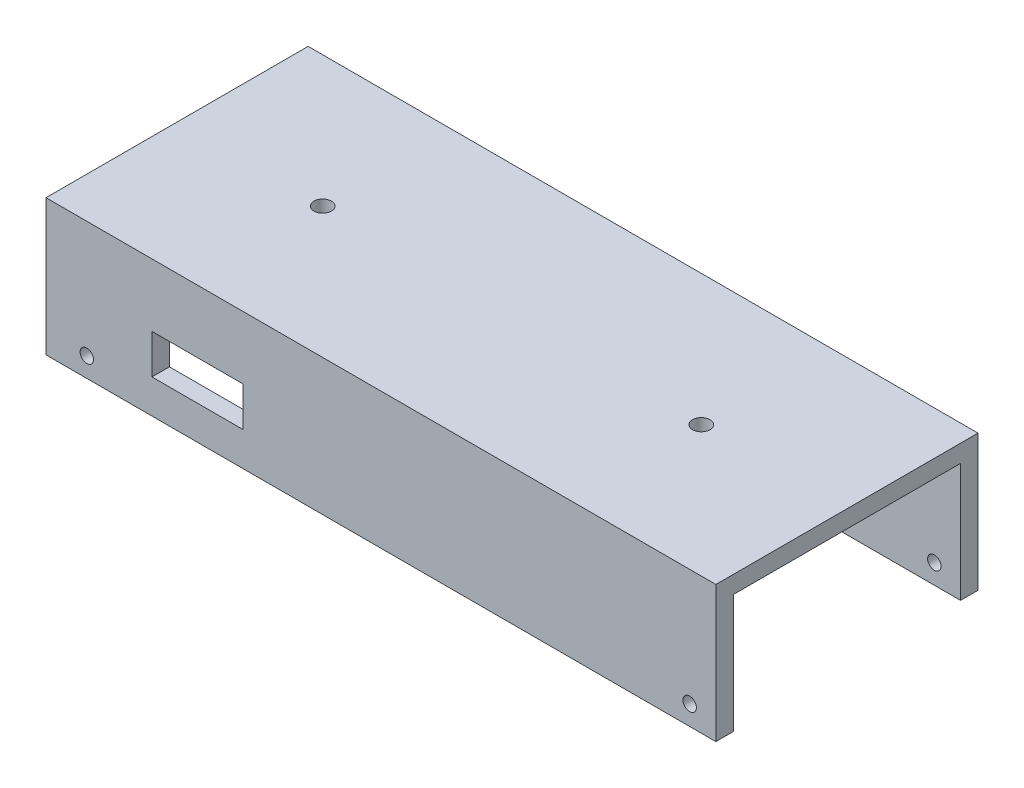
from build123d import *

# Parameters (mm, degrees)
SKETCH1_W           = 115
SKETCH1_H           = 27
BOSS_EXTRUDE5_DEPTH = 45
SHELL9_T            = -3
SKETCH3_R           = 1.15
CUT_EXTRUDE2_DEPTH  = 79
CUT_EXTRUDE8_DEPTH  = 23
SKETCH7_W           = 15.603868878
SKETCH7_H           = 6.773772537
CUT_EXTRUDE9_DEPTH  = 20
CUT_EXTRUDE10_DEPTH = 1
SKETCH10_R          = 1.5
CUT_EXTRUDE11_DEPTH = 26
SKETCH11_W          = 115
SKETCH11_H          = 3.63067128
CUT_EXTRUDE12_DEPTH = 68


with BuildPart() as part:
    # Sketch1 → Boss-Extrude5 (new body)
    with BuildSketch(Plane.XY):
        with Locations((57.5, 13.5)):
            Rectangle(SKETCH1_W, SKETCH1_H)
    extrude(amount=BOSS_EXTRUDE5_DEPTH)

    # Shell9
    shell9_openings = [part.faces().sort_by_distance(p)[0] for p in [
        (115, 13.5, 22.5),
        (57.5, 0, 22.5),
        (0, 13.5, 22.5),
    ]]
    offset(amount=SHELL9_T, openings=shell9_openings, kind=Kind.INTERSECTION)

    # Sketch3 → Cut-Extrude2 (cut)
    with BuildSketch(Plane(origin=(0, 0, 0), x_dir=(-1, 0, 0), z_dir=(0, 0, -1))):
        with Locations((-7, 7)):
            Circle(SKETCH3_R)
        with Locations((-110.5, 7)):
            Circle(SKETCH3_R)
    extrude(amount=-CUT_EXTRUDE2_DEPTH, mode=Mode.SUBTRACT)

    # Sketch6 → Cut-Extrude8 (cut)
    with BuildSketch(Plane(origin=(0, 0, 0), x_dir=(-1, 0, 0), z_dir=(0, 0, -1))):
        with BuildLine():
            Line((-45.043496676, 21.156136504), (-74.343496676, 21.156136504))
            ThreePointArc((-74.343496676, 21.156136504), (-76.093496676, 19.406136504), (-74.343496676, 17.656136504))
            Line((-74.343496676, 17.656136504), (-45.043496676, 17.656136504))
            ThreePointArc((-45.043496676, 17.656136504), (-43.293496676, 19.406136504), (-45.043496676, 21.156136504))
        make_face()
        with BuildLine():
            Line((-60.573496676, 16.060691718), (-89.873496676, 16.060691718))
            ThreePointArc((-89.873496676, 16.060691718), (-92.873496676, 13.060691718), (-89.873496676, 10.060691718))
            Line((-89.873496676, 10.060691718), (-60.573496676, 10.060691718))
            ThreePointArc((-60.573496676, 10.060691718), (-57.573496676, 13.060691718), (-60.573496676, 16.060691718))
        make_face()
        with BuildLine():
            ThreePointArc((-74.343496676, 8.465246931), (-76.093496676, 6.715246931), (-74.343496676, 4.965246931))
            Line((-74.343496676, 4.965246931), (-45.043496676, 4.965246931))
            ThreePointArc((-45.043496676, 4.965246931), (-43.293496676, 6.715246931), (-45.043496676, 8.465246931))
            Line((-45.043496676, 8.465246931), (-74.343496676, 8.465246931))
        make_face()
    extrude(amount=-CUT_EXTRUDE8_DEPTH, mode=Mode.SUBTRACT)

    # Sketch7 → Cut-Extrude9 (cut)
    with BuildSketch(Plane.XY.offset(45)):
        with Locations((25.989861683, 12.834718769)):
            Rectangle(SKETCH7_W, SKETCH7_H)
    extrude(amount=-CUT_EXTRUDE9_DEPTH, mode=Mode.SUBTRACT)

    # Sketch9 → Cut-Extrude10 (cut)
    # profile 1 of 6: a face of its own
    with BuildSketch(Plane.XZ.offset(-24)):
        with BuildLine():
            Line((2.360897436, 22.428821238), (2.645833333, 22.428821238))
            Line((2.645833333, 22.428821238), (2.645833333, 20.587550205))
            add(Edge.make_bspline(
                [(2.645833333, 20.587550205), (2.645582016, 20.54832753), (2.645096913, 20.472618319), (2.641603532, 20.363145879), (2.634236918, 20.262030216), (2.625883329, 20.168810167), (2.613866664, 20.083917824), (2.599192388, 20.007099874), (2.582650022, 19.9382826), (2.568117397, 19.895896494), (2.561242989, 19.875846479)],
                knots=[0, 0, 0, 0, 1.307562039, 2.523909702, 3.650326591, 4.686913197, 5.643429486, 6.506965704, 7.293745905, 8, 8, 8, 8], degree=3))
            add(Edge.make_bspline(
                [(2.561242989, 19.875846479), (2.551092751, 19.849784336), (2.53109576, 19.79843929), (2.493643793, 19.725655299), (2.451703037, 19.657123932), (2.403799771, 19.593227101), (2.350150613, 19.534285573), (2.292019545, 19.479018802), (2.228274443, 19.428596022), (2.158951754, 19.383887216), (2.085649501, 19.343621817), (2.008409823, 19.308745288), (1.927668268, 19.278367937), (1.842666359, 19.255614258), (1.754736789, 19.235897762), (1.662845548, 19.223066511), (1.567529511, 19.214333394), (1.502718345, 19.213525826), (1.469836739, 19.21311611)],
                knots=[0, 0, 0, 0, 0.981931301, 1.934503488, 2.87077864, 3.801706999, 4.735015492, 5.667491629, 6.616593066, 7.585388521, 8.561939025, 9.551802639, 10.560317337, 11.588439944, 12.640189604, 13.723962949, 14.845264515, 16, 16, 16, 16], degree=3))
            add(Edge.make_bspline(
                [(1.469836739, 19.21311611), (1.42186273, 19.213893065), (1.3281566, 19.215410667), (1.191536357, 19.233091711), (1.061783432, 19.258087464), (0.940612318, 19.295920245), (0.82878873, 19.342218085), (0.727076357, 19.395372079), (0.636388281, 19.45632238), (0.554633235, 19.525719354), (0.480844793, 19.608236408), (0.411423608, 19.705481074), (0.344602611, 19.818934609), (0.305442489, 19.902203713), (0.284935897, 19.945808418)],
                knots=[0, 0, 0, 0, 1.157897085, 2.2616841, 3.32207898, 4.345638746, 5.321241055, 6.241986252, 7.112515963, 7.955008012, 8.825025602, 9.77857164, 10.836726669, 12, 12, 12, 12], degree=3))
            Line((0.284935897, 19.945808418), (0.569871795, 19.945808418))
            add(Edge.make_bspline(
                [(0.569871795, 19.945808418), (0.592788228, 19.909426659), (0.637587032, 19.838304801), (0.721360297, 19.746217866), (0.813168893, 19.667520171), (0.916111177, 19.604101112), (1.030615479, 19.556285801), (1.156750687, 19.522199639), (1.295543201, 19.501792312), (1.392170438, 19.499332781), (1.442487981, 19.498052008)],
                knots=[0, 0, 0, 0, 0.997731894, 1.950442991, 2.880492273, 3.800895997, 4.748200782, 5.754801363, 6.83083817, 8, 8, 8, 8], degree=3))
            add(Edge.make_bspline(
                [(1.442487981, 19.498052008), (1.492169374, 19.499349357), (1.587950128, 19.501850516), (1.725682688, 19.522208747), (1.851408096, 19.556293219), (1.964401993, 19.604016541), (2.063331154, 19.662482267), (2.14861346, 19.72779662), (2.217687559, 19.801439387), (2.264145036, 19.869277168), (2.293023582, 19.929714772), (2.311413397, 19.981741769), (2.326357641, 20.040572594), (2.338857922, 20.106010012), (2.349172965, 20.178147515), (2.355707008, 20.257150045), (2.360429423, 20.342838054), (2.360737824, 20.402249687), (2.360897436, 20.432997921)],
                knots=[0, 0, 0, 0, 1.570740765, 3.028230971, 4.391408896, 5.680370741, 6.894727393, 8.017376726, 9.065722033, 10.075533815, 10.603371122, 11.180248986, 11.817768598, 12.521299649, 13.286540596, 14.121245857, 15.027658897, 16, 16, 16, 16], degree=3))
            Line((2.360897436, 20.432997921), (2.360897436, 20.553205253))
            add(Edge.make_bspline(
                [(2.360897436, 20.553205253), (2.331976708, 20.518786618), (2.274643959, 20.450554761), (2.175631741, 20.361145277), (2.067484967, 20.28414143), (1.950387754, 20.220987383), (1.82720842, 20.170476376), (1.699281111, 20.135149548), (1.567752604, 20.112325924), (1.478623868, 20.109870002), (1.433583734, 20.108628931)],
                knots=[0, 0, 0, 0, 1.012485704, 2.007162095, 2.997754123, 3.998611389, 4.999708251, 5.992315798, 6.98544096, 8, 8, 8, 8], degree=3))
            add(Edge.make_bspline(
                [(1.433583734, 20.108628931), (1.407062261, 20.109096133), (1.35433317, 20.110025009), (1.275997077, 20.1181519), (1.198816965, 20.129943617), (1.122972834, 20.147253208), (1.048355242, 20.169470703), (0.975087498, 20.197244458), (0.902576371, 20.228645316), (0.832139905, 20.265632073), (0.764479629, 20.306782166), (0.700105882, 20.351358159), (0.63935585, 20.399126749), (0.582807749, 20.450558973), (0.530535754, 20.505580392), (0.481836817, 20.563604473), (0.437516224, 20.625441445), (0.396664506, 20.689963757), (0.361233728, 20.757601166), (0.330132905, 20.82688701), (0.303091517, 20.89767314), (0.281532902, 20.970196547), (0.265067249, 21.044411509), (0.252811543, 21.120196444), (0.24586017, 21.197784725), (0.244776203, 21.25005552), (0.244230769, 21.276357296)],
                knots=[0, 0, 0, 0, 1.028754217, 2.045334182, 3.052854819, 4.056607503, 5.061168794, 6.071104265, 7.095078842, 8.125279047, 9.155117945, 10.165957491, 11.161587969, 12.151493252, 13.128948131, 14.104219989, 15.088194871, 16.07871515, 17.064853787, 18.047899887, 19.02414258, 20.002704429, 20.980574569, 21.971845993, 22.979467364, 24, 24, 24, 24], degree=3))
            add(Edge.make_bspline(
                [(0.244230769, 21.276357296), (0.244701727, 21.302667247), (0.245641819, 21.355185248), (0.253761636, 21.433090119), (0.265344208, 21.509951821), (0.283675541, 21.584978107), (0.305739544, 21.659023417), (0.333065927, 21.731540831), (0.365921516, 21.802552436), (0.403123218, 21.872110818), (0.444928073, 21.939282583), (0.490768252, 22.003078897), (0.540699095, 22.06303031), (0.594031762, 22.119741636), (0.651417453, 22.172665705), (0.712826482, 22.221674066), (0.777653523, 22.267588218), (0.846099493, 22.309417788), (0.917108266, 22.346413112), (0.988875801, 22.380170253), (1.062352772, 22.406961919), (1.136169289, 22.430568587), (1.211625355, 22.447291943), (1.287795776, 22.460193548), (1.364941326, 22.468053688), (1.416605737, 22.46903484), (1.442487981, 22.469526366)],
                knots=[0, 0, 0, 0, 1.008818848, 2.013730394, 3.001654427, 3.987803273, 4.973046549, 5.963777569, 6.957074694, 7.972068341, 8.987420212, 9.989399531, 10.982630087, 11.977756091, 12.973280677, 13.973972381, 14.989194003, 16.018387222, 17.047741039, 18.059210846, 19.057554164, 20.045176975, 21.029480261, 22.018708529, 23.007435371, 24, 24, 24, 24], degree=3))
            add(Edge.make_bspline(
                [(1.442487981, 22.469526366), (1.485169904, 22.46829567), (1.569453588, 22.465865423), (1.69348814, 22.446796241), (1.8131786, 22.416394243), (1.929200372, 22.372837207), (2.042498569, 22.313373958), (2.152699785, 22.235048569), (2.260122857, 22.137158475), (2.326414889, 22.062089805), (2.360897436, 22.023041991)],
                knots=[0, 0, 0, 0, 0.96728863, 1.910097829, 2.838038873, 3.762875196, 4.71315279, 5.730631239, 6.819562287, 8, 8, 8, 8], degree=3))
            Line((2.360897436, 22.023041991), (2.360897436, 22.428821238))
        make_face()
        with BuildLine():
            add(Edge.make_bspline(
                [(1.465384615, 22.184590469), (1.423718905, 22.18317436), (1.341229635, 22.180370763), (1.220318067, 22.156436059), (1.103589706, 22.118929421), (0.99327621, 22.06527862), (0.889946189, 21.999878847), (0.798256888, 21.920648729), (0.718060999, 21.830164679), (0.650222191, 21.729244812), (0.596218737, 21.620367462), (0.557988635, 21.505604153), (0.533268971, 21.386809267), (0.530540601, 21.305735549), (0.529166667, 21.264908979)],
                knots=[0, 0, 0, 0, 1.026226791, 2.031711442, 3.026614839, 4.04107745, 5.047145931, 6.032893242, 7.017642609, 8.019221815, 9.021877557, 10.003543541, 10.994637589, 12, 12, 12, 12], degree=3))
            add(Edge.make_bspline(
                [(0.529166667, 21.264908979), (0.529825032, 21.234126653), (0.531119843, 21.17358682), (0.543569089, 21.084743158), (0.563690393, 21.000124588), (0.59220843, 20.919725991), (0.627544089, 20.843086213), (0.671987169, 20.770733193), (0.724284836, 20.702602495), (0.784027757, 20.639198034), (0.849864903, 20.581448441), (0.921274462, 20.530704647), (0.998159582, 20.489202207), (1.078629331, 20.453333019), (1.164636231, 20.427135579), (1.254941473, 20.407143258), (1.350183941, 20.395705313), (1.415109733, 20.394287632), (1.448212139, 20.393564828)],
                knots=[0, 0, 0, 0, 1.039728707, 2.044842319, 3.024901384, 3.974314358, 4.923051295, 5.871625912, 6.837440708, 7.820715446, 8.810779094, 9.792721783, 10.773906224, 11.758876063, 12.764959493, 13.806266761, 14.881525401, 16, 16, 16, 16], degree=3))
            add(Edge.make_bspline(
                [(1.448212139, 20.393564828), (1.481743549, 20.394261159), (1.547313864, 20.395622827), (1.643081785, 20.407328144), (1.733825771, 20.426216651), (1.819462617, 20.453034538), (1.900315662, 20.487253555), (1.975476634, 20.530557486), (2.046557126, 20.579873792), (2.111287583, 20.637397548), (2.169820219, 20.700793222), (2.220829558, 20.769776806), (2.264294808, 20.843310276), (2.300288123, 20.921385346), (2.327766572, 21.004608766), (2.346198722, 21.092772489), (2.359086269, 21.185454131), (2.360284536, 21.248961947), (2.360897436, 21.281445437)],
                knots=[0, 0, 0, 0, 1.121943988, 2.193949579, 3.223793937, 4.220241907, 5.192961521, 6.155822191, 7.11847367, 8.083710714, 9.04790392, 10.001595906, 10.949595423, 11.902125208, 12.873731292, 13.87582262, 14.913508608, 16, 16, 16, 16], degree=3))
            add(Edge.make_bspline(
                [(2.360897436, 21.281445437), (2.359682256, 21.32373449), (2.357308222, 21.40635244), (2.334904372, 21.526736436), (2.298781753, 21.639919448), (2.24812077, 21.745543511), (2.184637091, 21.84248946), (2.10817325, 21.928961805), (2.020047922, 22.005071868), (1.920514302, 22.068479514), (1.813428406, 22.11970173), (1.701377035, 22.158129909), (1.584526545, 22.179896181), (1.505327159, 22.1830167), (1.465384615, 22.184590469)],
                knots=[0, 0, 0, 0, 1.070913519, 2.092188694, 3.091357305, 4.074328408, 5.051968682, 6.018948707, 6.99050112, 7.9935919, 9.000589572, 9.992915277, 10.987769056, 12, 12, 12, 12], degree=3))
        make_face(mode=Mode.SUBTRACT)
    # profile 2 of 6: a face of its own
    with BuildSketch(Plane.XZ.offset(-24)):
        with BuildLine():
            Line((3.215705128, 22.428821238), (3.500641026, 22.428821238))
            Line((3.500641026, 22.428821238), (3.500641026, 22.087279772))
            add(Edge.make_bspline(
                [(3.500641026, 22.087279772), (3.521676543, 22.119080416), (3.561906805, 22.179898901), (3.628774962, 22.260334624), (3.69726727, 22.326932559), (3.767711619, 22.380003609), (3.840626038, 22.419748366), (3.914410273, 22.448861334), (3.990225163, 22.46607647), (4.041172051, 22.468374861), (4.066696715, 22.469526366)],
                knots=[0, 0, 0, 0, 1.2804753, 2.448899062, 3.506932113, 4.484331642, 5.4025378, 6.288909075, 7.142734305, 8, 8, 8, 8], degree=3))
            add(Edge.make_bspline(
                [(4.066696715, 22.469526366), (4.086496311, 22.468446389), (4.127235267, 22.466224264), (4.188905188, 22.450611588), (4.252444605, 22.425685096), (4.293395199, 22.402244323), (4.31474359, 22.390024163)],
                knots=[0, 0, 0, 0, 0.901110191, 1.854092781, 2.881294221, 4, 4, 4, 4], degree=3))
            Line((4.31474359, 22.390024163), (4.158283253, 22.143249323))
            add(Edge.make_bspline(
                [(4.158283253, 22.143249323), (4.144577213, 22.149363707), (4.118560524, 22.160969979), (4.080501739, 22.174705946), (4.04541224, 22.182793955), (4.023057012, 22.184019249), (4.012635216, 22.184590469)],
                knots=[0, 0, 0, 0, 1.180555205, 2.24091978, 3.179933427, 4, 4, 4, 4], degree=3))
            add(Edge.make_bspline(
                [(4.012635216, 22.184590469), (3.989770015, 22.183066435), (3.943131633, 22.179957848), (3.874656408, 22.155520501), (3.808210729, 22.11603689), (3.755440721, 22.072248096), (3.714580963, 22.030022594), (3.685425187, 21.993148686), (3.658680124, 21.951802356), (3.63312571, 21.906690428), (3.609842714, 21.857042639), (3.588112407, 21.80335501), (3.568464724, 21.745565357), (3.557261289, 21.705304071), (3.551522436, 21.684680613)],
                knots=[0, 0, 0, 0, 1.125678352, 2.296057538, 3.5422874, 4.923748041, 5.663163013, 6.437101912, 7.23742474, 8.08941207, 8.991984279, 9.93940061, 10.944477711, 12, 12, 12, 12], degree=3))
            add(Edge.make_bspline(
                [(3.551522436, 21.684680613), (3.547229479, 21.66628632), (3.537720906, 21.625544358), (3.528475725, 21.557192482), (3.519341234, 21.476435306), (3.512903587, 21.38304804), (3.506936363, 21.277263894), (3.503570789, 21.158921715), (3.500755797, 21.027900032), (3.500680443, 20.936301869), (3.500641026, 20.888386543)],
                knots=[0, 0, 0, 0, 0.566838948, 1.255505196, 2.06880316, 3.007127437, 4.065329342, 5.249902469, 6.561414163, 8, 8, 8, 8], degree=3))
            Line((3.500641026, 20.888386543), (3.500641026, 20.108628931))
            Line((3.500641026, 20.108628931), (3.215705128, 20.108628931))
            Line((3.215705128, 20.108628931), (3.215705128, 22.428821238))
        make_face()
    # profile 3 of 6: a face of its own
    with BuildSketch(Plane.XZ.offset(-24)):
        with BuildLine():
            add(Edge.make_bspline(
                [(5.720342548, 22.469526366), (5.763877488, 22.468599365), (5.849238867, 22.466781742), (5.974250306, 22.447355309), (6.093580537, 22.417648772), (6.207686583, 22.376580997), (6.315107079, 22.321533799), (6.417406708, 22.255848228), (6.514304994, 22.178031161), (6.572383028, 22.117834913), (6.601862981, 22.087279772)],
                knots=[0, 0, 0, 0, 1.054011418, 2.066658804, 3.057071809, 4.030435133, 4.997543892, 5.974964718, 6.972108034, 8, 8, 8, 8], degree=3))
            add(Edge.make_bspline(
                [(6.601862981, 22.087279772), (6.627246611, 22.058057085), (6.677522627, 22.00017725), (6.741989386, 21.90632823), (6.797526087, 21.809136853), (6.842033202, 21.707312492), (6.877126045, 21.60174404), (6.902041355, 21.492068645), (6.916861289, 21.378528515), (6.918859694, 21.301417891), (6.919871795, 21.262364908)],
                knots=[0, 0, 0, 0, 1.025258237, 2.030674902, 3.01204498, 3.988269485, 4.97094183, 5.956517959, 6.965070386, 8, 8, 8, 8], degree=3))
            add(Edge.make_bspline(
                [(6.919871795, 21.262364908), (6.918981582, 21.22308557), (6.917222479, 21.145467766), (6.900582198, 21.031150199), (6.874700428, 20.920302038), (6.837660117, 20.813387366), (6.790163833, 20.710079373), (6.732205852, 20.610829281), (6.663379456, 20.515441275), (6.585361545, 20.424725322), (6.499135914, 20.341117398), (6.405594837, 20.268248182), (6.306576535, 20.205817228), (6.20076435, 20.155528479), (6.089124558, 20.115877537), (5.971416361, 20.088028236), (5.847822619, 20.071190138), (5.763433639, 20.069027896), (5.720342548, 20.067923802)],
                knots=[0, 0, 0, 0, 0.998656419, 1.973391657, 2.932242238, 3.890759089, 4.846373663, 5.82037756, 6.809684879, 7.83454468, 8.860553229, 9.859544525, 10.845671541, 11.83227036, 12.833544569, 13.85385346, 14.904124723, 16, 16, 16, 16], degree=3))
            add(Edge.make_bspline(
                [(5.720342548, 20.067923802), (5.677040338, 20.069031602), (5.592230773, 20.071201283), (5.468200775, 20.087962818), (5.35028162, 20.115864702), (5.238495677, 20.155658785), (5.132228566, 20.205818835), (5.03263653, 20.268059439), (4.939019464, 20.341139009), (4.852775592, 20.424719466), (4.774762571, 20.515442784), (4.705934914, 20.61082889), (4.647977261, 20.710079475), (4.60048089, 20.813387339), (4.563440603, 20.920302045), (4.537558826, 21.031150197), (4.520918547, 21.145467767), (4.519159444, 21.22308557), (4.518269231, 21.262364908)],
                knots=[0, 0, 0, 0, 1.099876186, 2.154163076, 3.173186993, 4.173200201, 5.163417411, 6.152872554, 7.150605724, 8.17532212, 9.198891216, 10.186952605, 11.159729845, 12.11414092, 13.071450619, 14.029093627, 15.002601286, 16, 16, 16, 16], degree=3))
            add(Edge.make_bspline(
                [(4.518269231, 21.262364908), (4.519288234, 21.301205632), (4.521305684, 21.37810359), (4.536110718, 21.491430281), (4.560928837, 21.600920055), (4.596063746, 21.706081022), (4.640981098, 21.807459168), (4.695737409, 21.904890693), (4.760861769, 21.998315341), (4.810937825, 22.056120371), (4.836278045, 22.085371719)],
                knots=[0, 0, 0, 0, 1.031353054, 2.041901799, 3.029428768, 4.008703097, 4.981709435, 5.96992636, 6.972712378, 8, 8, 8, 8], degree=3))
            add(Edge.make_bspline(
                [(4.836278045, 22.085371719), (4.865713552, 22.116191843), (4.923603658, 22.176805038), (5.020984289, 22.254395257), (5.123032255, 22.321447695), (5.231639867, 22.375401119), (5.345652174, 22.417890346), (5.465593915, 22.44743192), (5.591029561, 22.466711749), (5.676808646, 22.468578811), (5.720342548, 22.469526366)],
                knots=[0, 0, 0, 0, 1.027980169, 2.021703884, 2.998553061, 3.971491411, 4.943284454, 5.930300938, 6.949603206, 8, 8, 8, 8], degree=3))
        make_face()
        with BuildLine():
            add(Edge.make_bspline(
                [(5.719070513, 22.184590469), (5.688284251, 22.183715447), (5.62750647, 22.18198799), (5.538044418, 22.16884902), (5.451920136, 22.148032355), (5.368970227, 22.118455818), (5.289474421, 22.080266103), (5.213356606, 22.033359233), (5.140392892, 21.97835648), (5.072010592, 21.915343914), (5.009252352, 21.846510826), (4.954390187, 21.773169814), (4.907740269, 21.696510486), (4.868878125, 21.616453123), (4.839933747, 21.532186433), (4.818912506, 21.444664718), (4.80578593, 21.353709661), (4.804074715, 21.291877881), (4.803205128, 21.260456855)],
                knots=[0, 0, 0, 0, 1.021534396, 2.016698045, 2.994645724, 3.958388632, 4.93408049, 5.916473867, 6.921342795, 7.962252576, 8.998418191, 10.008913653, 10.997312074, 11.973003931, 12.956656626, 13.948281152, 14.957379055, 16, 16, 16, 16], degree=3))
            add(Edge.make_bspline(
                [(4.803205128, 21.260456855), (4.804662747, 21.219860373), (4.807555847, 21.139283948), (4.831082812, 21.020619573), (4.870440365, 20.906698893), (4.923587398, 20.798189743), (4.990177325, 20.697794176), (5.06863345, 20.608285044), (5.158113749, 20.531009343), (5.257551574, 20.466891719), (5.364915848, 20.415946798), (5.478541225, 20.379843442), (5.597050998, 20.356374121), (5.678041375, 20.354041426), (5.719070513, 20.3528597)],
                knots=[0, 0, 0, 0, 1.016792936, 2.018143844, 3.017858371, 4.030088057, 5.03801393, 6.028138512, 7.003788237, 7.991172063, 8.984598303, 9.972568034, 10.972917682, 12, 12, 12, 12], degree=3))
            add(Edge.make_bspline(
                [(5.719070513, 20.3528597), (5.76009729, 20.354048311), (5.84108301, 20.356394597), (5.95942812, 20.379725241), (6.072742937, 20.41610499), (6.179995696, 20.466834423), (6.279388258, 20.531252828), (6.369512103, 20.607848684), (6.447298344, 20.69803125), (6.513822399, 20.798322722), (6.567839802, 20.90653067), (6.607013135, 21.020640599), (6.630596659, 21.139278594), (6.633482125, 21.219858579), (6.634935897, 21.260456855)],
                knots=[0, 0, 0, 0, 1.02726834, 2.027799167, 3.010890988, 4.004497153, 4.992059811, 5.971914811, 6.958719428, 7.966827853, 8.981595046, 9.981490638, 10.983022906, 12, 12, 12, 12], degree=3))
            add(Edge.make_bspline(
                [(6.634935897, 21.260456855), (6.63406661, 21.291878068), (6.632355984, 21.353710219), (6.619225123, 21.444662587), (6.598219741, 21.53219425), (6.569216917, 21.616424282), (6.530523633, 21.696717768), (6.482974113, 21.772944734), (6.428335969, 21.846764887), (6.364820438, 21.915121404), (6.296509516, 21.978381044), (6.223516232, 22.033380562), (6.147511287, 22.080059952), (6.06824643, 22.11878247), (5.985285886, 22.147763272), (5.899282276, 22.168969216), (5.810201927, 22.181932466), (5.749641938, 22.183698801), (5.719070513, 22.184590469)],
                knots=[0, 0, 0, 0, 1.042956736, 2.052379634, 3.044323526, 4.02829302, 5.004299113, 5.996692471, 7.007513377, 8.048758398, 9.090003419, 10.095195979, 11.07790575, 12.047570684, 13.018257071, 13.989683339, 14.985167495, 16, 16, 16, 16], degree=3))
        make_face(mode=Mode.SUBTRACT)
    # profile 4 of 6: a face of its own
    with BuildSketch(Plane.XZ.offset(-24)):
        with BuildLine():
            Line((7.449038462, 22.428821238), (7.733974359, 22.428821238))
            Line((7.733974359, 22.428821238), (7.733974359, 21.352679411))
            add(Edge.make_bspline(
                [(7.733974359, 21.352679411), (7.734103087, 21.321090203), (7.734349338, 21.260661528), (7.736019334, 21.17370718), (7.739947348, 21.094407733), (7.74485846, 21.022717379), (7.751174112, 20.958648245), (7.758688303, 20.902424114), (7.767087014, 20.85340739), (7.77530819, 20.823885917), (7.779131611, 20.810156375)],
                knots=[0, 0, 0, 0, 1.388932606, 2.656963016, 3.823490214, 4.879454478, 5.816252168, 6.653371382, 7.373723809, 8, 8, 8, 8], degree=3))
            add(Edge.make_bspline(
                [(7.779131611, 20.810156375), (7.785265216, 20.792899913), (7.797404911, 20.758745748), (7.819424429, 20.70940715), (7.84666442, 20.663709572), (7.876472978, 20.619890878), (7.910853155, 20.579249075), (7.949369961, 20.541852797), (7.990734076, 20.506289086), (8.052197561, 20.464211453), (8.136252752, 20.419112547), (8.246609181, 20.380199911), (8.366265157, 20.35694456), (8.448964581, 20.354246486), (8.491471354, 20.3528597)],
                knots=[0, 0, 0, 0, 0.725840625, 1.436591201, 2.137033971, 2.831655856, 3.53531722, 4.242432219, 4.957935707, 5.694543706, 7.190802206, 8.724350549, 10.316345118, 12, 12, 12, 12], degree=3))
            add(Edge.make_bspline(
                [(8.491471354, 20.3528597), (8.533974179, 20.354275975), (8.616209281, 20.357016206), (8.734550575, 20.379498416), (8.842728643, 20.417059291), (8.939657721, 20.469498872), (9.024898161, 20.533672029), (9.095931455, 20.608972877), (9.154539465, 20.693019107), (9.180129439, 20.755724702), (9.192998798, 20.78725974)],
                knots=[0, 0, 0, 0, 1.157059328, 2.238695713, 3.266970494, 4.264342957, 5.228770407, 6.160125903, 7.074715775, 8, 8, 8, 8], degree=3))
            add(Edge.make_bspline(
                [(9.192998798, 20.78725974), (9.196803564, 20.799929168), (9.205214972, 20.827938179), (9.214252248, 20.875454094), (9.222393367, 20.932118414), (9.229344962, 20.998301932), (9.234302645, 21.073831691), (9.236975112, 21.158684089), (9.239994334, 21.252592751), (9.240040159, 21.318331362), (9.240064103, 21.352679411)],
                knots=[0, 0, 0, 0, 0.557542046, 1.232589297, 2.036731608, 2.971723315, 4.038036528, 5.22795436, 6.551621927, 8, 8, 8, 8], degree=3))
            Line((9.240064103, 21.352679411), (9.240064103, 22.428821238))
            Line((9.240064103, 22.428821238), (9.525, 22.428821238))
            Line((9.525, 22.428821238), (9.525, 21.299253931))
            add(Edge.make_bspline(
                [(9.525, 21.299253931), (9.52459932, 21.260875282), (9.523821945, 21.186415454), (9.518825998, 21.078207725), (9.510253849, 20.977367688), (9.497242985, 20.883841967), (9.481943409, 20.797701966), (9.462207361, 20.718837283), (9.438641388, 20.647490902), (9.4120571, 20.582410861), (9.38065012, 20.523404036), (9.347242751, 20.467400831), (9.308666708, 20.415790811), (9.26805371, 20.366004872), (9.222876494, 20.320519344), (9.173981622, 20.278290505), (9.122057291, 20.238672826), (9.065951233, 20.203211451), (9.006482518, 20.171264923), (8.943577734, 20.142947481), (8.8764664, 20.120538715), (8.806014386, 20.101206896), (8.731876522, 20.086044485), (8.65412428, 20.075352385), (8.572783849, 20.068797978), (8.517348839, 20.068220087), (8.488927284, 20.067923802)],
                knots=[0, 0, 0, 0, 1.493040784, 2.896703357, 4.213163133, 5.428574705, 6.569057535, 7.615249723, 8.588095153, 9.490268104, 10.346124644, 11.18633936, 12.024365274, 12.850166724, 13.684164916, 14.514361689, 15.362232829, 16.222528818, 17.093394965, 17.986930858, 18.902426812, 19.842810585, 20.827885679, 21.843828298, 22.894529745, 24, 24, 24, 24], degree=3))
            add(Edge.make_bspline(
                [(8.488927284, 20.067923802), (8.460718303, 20.068231965), (8.40528503, 20.068837534), (8.323940401, 20.075316174), (8.245972737, 20.086027872), (8.171659233, 20.101317962), (8.100925315, 20.120403404), (8.033484469, 20.143085182), (7.97012638, 20.171279619), (7.910089847, 20.203009261), (7.853844824, 20.238900618), (7.801132042, 20.278241625), (7.752022183, 20.320973554), (7.706504414, 20.366917942), (7.665217643, 20.416644734), (7.627647376, 20.469753921), (7.593215222, 20.525719273), (7.562052334, 20.585647999), (7.535280956, 20.651481179), (7.511645125, 20.724322117), (7.492313332, 20.8049694), (7.476581236, 20.893354078), (7.463925286, 20.989053152), (7.455138571, 21.092620214), (7.450225639, 21.203802992), (7.449442719, 21.280592535), (7.449038462, 21.320242512)],
                knots=[0, 0, 0, 0, 1.083640291, 2.129454052, 3.13281866, 4.105697902, 5.042300162, 5.946461698, 6.836384745, 7.703652036, 8.553297018, 9.397182691, 10.228592656, 11.052265423, 11.879314572, 12.708807002, 13.549817954, 14.402308542, 15.300838682, 16.27712199, 17.341985831, 18.484375296, 19.725102775, 21.0496083, 22.476576903, 24, 24, 24, 24], degree=3))
            Line((7.449038462, 21.320242512), (7.449038462, 22.428821238))
        make_face()
    # profile 5 of 6: a face of its own
    with BuildSketch(Plane.XZ.offset(-24)):
        with BuildLine():
            Line((10.176282051, 22.428821238), (10.461217949, 22.428821238))
            Line((10.461217949, 22.428821238), (10.461217949, 21.999509339))
            add(Edge.make_bspline(
                [(10.461217949, 21.999509339), (10.491477952, 22.038459998), (10.550282213, 22.114152808), (10.651632662, 22.212115282), (10.758609125, 22.294733593), (10.873964506, 22.359487748), (10.995905996, 22.408310913), (11.12393317, 22.444396557), (11.259132621, 22.465661323), (11.35156726, 22.468220973), (11.398707933, 22.469526366)],
                knots=[0, 0, 0, 0, 1.0828784, 2.104357462, 3.088488658, 4.04616522, 5.001424249, 5.969181776, 6.964304535, 8, 8, 8, 8], degree=3))
            add(Edge.make_bspline(
                [(11.398707933, 22.469526366), (11.439884601, 22.468335126), (11.52127245, 22.465980576), (11.641072665, 22.450039305), (11.756438906, 22.422718255), (11.866718497, 22.383347425), (11.973092849, 22.334674248), (12.073987183, 22.273245223), (12.170973051, 22.202119607), (12.261611308, 22.120266156), (12.345359977, 22.031703372), (12.41779187, 21.936433139), (12.480268526, 21.837588507), (12.530769438, 21.733637109), (12.570328439, 21.625397522), (12.598463182, 21.512432436), (12.615206902, 21.39516069), (12.617453397, 21.315420365), (12.618589744, 21.275085261)],
                knots=[0, 0, 0, 0, 1.041296284, 2.058176809, 3.050446431, 4.034000596, 5.01514041, 6.003636468, 7.015969324, 8.052561599, 9.08815499, 10.094063707, 11.074456064, 12.040834395, 13.011057502, 13.983766392, 14.980127149, 16, 16, 16, 16], degree=3))
            add(Edge.make_bspline(
                [(12.618589744, 21.275085261), (12.617478053, 21.233898881), (12.615285639, 21.152673396), (12.598281241, 21.033395815), (12.571106076, 20.918653697), (12.532046153, 20.808637894), (12.481571374, 20.703424153), (12.420153666, 20.603088351), (12.347685228, 20.507662635), (12.264862062, 20.418442504), (12.175006899, 20.336255984), (12.078960891, 20.264375735), (11.978214579, 20.204013202), (11.873283399, 20.153591517), (11.76326907, 20.115589322), (11.648684882, 20.08817746), (11.529593221, 20.07127331), (11.448584319, 20.069048867), (11.407612179, 20.067923802)],
                knots=[0, 0, 0, 0, 1.038740735, 2.04854663, 3.033179607, 4.009277356, 4.987731542, 5.972001279, 6.972200261, 8.005528982, 9.039189865, 10.040446548, 11.026516639, 11.997840187, 12.972163198, 13.956796175, 14.96660207, 16, 16, 16, 16], degree=3))
            add(Edge.make_bspline(
                [(11.407612179, 20.067923802), (11.361504311, 20.069098378), (11.270427752, 20.071418509), (11.137261294, 20.094931117), (11.009103007, 20.130071051), (10.887372759, 20.181505138), (10.771106243, 20.247051213), (10.660961133, 20.326979757), (10.556352365, 20.42112361), (10.493388706, 20.492544615), (10.461217949, 20.529036583)],
                knots=[0, 0, 0, 0, 1.014726462, 2.004382257, 2.969841629, 3.936926163, 4.907207904, 5.903978561, 6.929055279, 8, 8, 8, 8], degree=3))
            Line((10.461217949, 20.529036583), (10.461217949, 19.253821238))
            Line((10.461217949, 19.253821238), (10.176282051, 19.253821238))
            Line((10.176282051, 19.253821238), (10.176282051, 22.428821238))
        make_face()
        with BuildLine():
            add(Edge.make_bspline(
                [(11.396163862, 22.184590469), (11.363888116, 22.184009663), (11.300345492, 22.182866207), (11.207207122, 22.169282696), (11.117494841, 22.149563459), (11.032112785, 22.119707664), (10.950242583, 22.083060169), (10.872514805, 22.037265773), (10.798984011, 21.983152882), (10.729835205, 21.921758049), (10.66736636, 21.854108153), (10.612064276, 21.781910641), (10.565611935, 21.705256943), (10.52705653, 21.624861078), (10.497716553, 21.540092855), (10.476892435, 21.451435051), (10.463802044, 21.358790626), (10.462088508, 21.295693392), (10.461217949, 21.263636943)],
                knots=[0, 0, 0, 0, 1.05670511, 2.080379991, 3.077984906, 4.06214886, 5.038337365, 6.01289324, 7.01187578, 8.025460281, 9.038092164, 10.024533457, 11.000252242, 11.969694649, 12.940728589, 13.933144304, 14.949937299, 16, 16, 16, 16], degree=3))
            add(Edge.make_bspline(
                [(10.461217949, 21.263636943), (10.462661082, 21.221556298), (10.465488304, 21.139116751), (10.488472916, 21.018662583), (10.525879191, 20.904678582), (10.578973096, 20.798124641), (10.64605411, 20.700168783), (10.726878866, 20.61245659), (10.820716037, 20.535539411), (10.926005561, 20.470750131), (11.038874208, 20.418146671), (11.156608571, 20.380487351), (11.27758957, 20.357289687), (11.359385117, 20.354344358), (11.400615986, 20.3528597)],
                knots=[0, 0, 0, 0, 1.03728447, 2.032128127, 3.01272805, 3.987917167, 4.958271349, 5.931593992, 6.91984656, 7.941419022, 8.973179163, 9.983609215, 10.983593296, 12, 12, 12, 12], degree=3))
            add(Edge.make_bspline(
                [(11.400615986, 20.3528597), (11.441016289, 20.354271556), (11.521203629, 20.357073837), (11.63927564, 20.381329193), (11.754020719, 20.418381465), (11.863041304, 20.472410491), (11.965388325, 20.538622901), (12.057809448, 20.618052359), (12.138551434, 20.710118237), (12.207371242, 20.812633093), (12.262826232, 20.922556476), (12.304491521, 21.036295308), (12.328538584, 21.153448656), (12.331946528, 21.232368009), (12.333653846, 21.271905173)],
                knots=[0, 0, 0, 0, 1.00104056, 1.986885549, 2.97790532, 3.984399681, 4.995088187, 5.994304198, 6.996462723, 8.023150851, 9.048424203, 10.043036403, 11.019596776, 12, 12, 12, 12], degree=3))
            add(Edge.make_bspline(
                [(12.333653846, 21.271905173), (12.332334195, 21.311687913), (12.329705173, 21.390943445), (12.303808932, 21.507749793), (12.264892524, 21.621948171), (12.208142527, 21.730370384), (12.140831375, 21.832672588), (12.059418028, 21.922982178), (11.968144764, 22.002058431), (11.865919594, 22.067386696), (11.756209351, 22.119352823), (11.640716534, 22.157347267), (11.52002698, 22.180183454), (11.437814751, 22.183108542), (11.396163862, 22.184590469)],
                knots=[0, 0, 0, 0, 0.983928682, 1.960191568, 2.949917689, 3.96440592, 4.982380491, 5.975291189, 6.965713506, 7.964880129, 8.970154049, 9.96478489, 10.968906225, 12, 12, 12, 12], degree=3))
        make_face(mode=Mode.SUBTRACT)
    # profile 6 of 6: a face of its own
    with BuildSketch(Plane.XZ.offset(-24)):
        with BuildLine():
            Line((14.613141026, 22.306705854), (14.328205128, 22.306705854))
            add(Edge.make_bspline(
                [(14.328205128, 22.306705854), (14.330062188, 22.344507302), (14.333709405, 22.41874834), (14.350789353, 22.526992169), (14.375228578, 22.630456165), (14.409782968, 22.728309587), (14.45269652, 22.821417648), (14.504158759, 22.90941052), (14.565113181, 22.991952527), (14.634243575, 23.068278477), (14.709326555, 23.138298631), (14.7903398, 23.198764458), (14.875470646, 23.249852631), (14.964460815, 23.292562044), (15.058314327, 23.324620332), (15.15617949, 23.348407106), (15.258486278, 23.362718505), (15.328191156, 23.364256825), (15.363641827, 23.365039187)],
                knots=[0, 0, 0, 0, 1.10065271, 2.161652631, 3.183658789, 4.190468796, 5.17591951, 6.163126047, 7.15150782, 8.156236427, 9.156009102, 10.134482811, 11.092018607, 12.041330605, 13.001268258, 13.972401359, 14.968799086, 16, 16, 16, 16], degree=3))
            add(Edge.make_bspline(
                [(15.363641827, 23.365039187), (15.398456223, 23.364224159), (15.466865267, 23.362622657), (15.566707237, 23.348869438), (15.661755211, 23.327328794), (15.7518234, 23.297106952), (15.836193187, 23.256481078), (15.915498377, 23.207679026), (15.990683113, 23.15123675), (16.058362123, 23.084785076), (16.120508738, 23.013844342), (16.174122927, 22.938108886), (16.220036296, 22.859886606), (16.258306549, 22.778581023), (16.286478904, 22.69342659), (16.307867707, 22.605663056), (16.319957575, 22.514381977), (16.321813066, 22.452599602), (16.32275641, 22.421189027)],
                knots=[0, 0, 0, 0, 1.111607364, 2.184268762, 3.212621178, 4.221274766, 5.211760367, 6.196651075, 7.1921475, 8.207485113, 9.220403448, 10.201281604, 11.166441695, 12.114753415, 13.065576456, 14.026450734, 14.996634279, 16, 16, 16, 16], degree=3))
            add(Edge.make_bspline(
                [(16.32275641, 22.421189027), (16.321220379, 22.376967777), (16.318175272, 22.289301297), (16.29212723, 22.160473529), (16.251445038, 22.035656642), (16.202461721, 21.935202089), (16.153047433, 21.854254563), (16.108518051, 21.787607952), (16.056389258, 21.715847991), (15.995902335, 21.639214978), (15.928308515, 21.557108657), (15.852995552, 21.469578628), (15.769426394, 21.377529237), (15.710771897, 21.314659156), (15.680378606, 21.282081455)],
                knots=[0, 0, 0, 0, 1.184426356, 2.348067706, 3.509069118, 4.696110526, 5.333549288, 6.050745305, 6.844228056, 7.710549037, 8.667450064, 9.695053472, 10.805634456, 12, 12, 12, 12], degree=3))
            Line((15.680378606, 21.282081455), (14.885992588, 20.434269956))
            Line((14.885992588, 20.434269956), (16.363461538, 20.434269956))
            Line((16.363461538, 20.434269956), (16.363461538, 20.108628931))
            Line((16.363461538, 20.108628931), (14.206089744, 20.108628931))
            Line((14.206089744, 20.108628931), (15.437419872, 21.42264135))
            add(Edge.make_bspline(
                [(15.437419872, 21.42264135), (15.467399026, 21.453936243), (15.524982847, 21.514047326), (15.60642847, 21.601807012), (15.679579552, 21.683222666), (15.744909616, 21.758140464), (15.801001438, 21.827656243), (15.850778392, 21.889518582), (15.890661463, 21.946445833), (15.933946144, 22.012431961), (15.975868827, 22.09299742), (16.011893607, 22.191452981), (16.033859934, 22.292805561), (16.036495035, 22.361296694), (16.037820513, 22.395748322)],
                knots=[0, 0, 0, 0, 1.329631726, 2.553950428, 3.673215718, 4.687767853, 5.603093632, 6.413772471, 7.123043292, 7.734684054, 8.834405432, 9.900288307, 10.943827018, 12, 12, 12, 12], degree=3))
            add(Edge.make_bspline(
                [(16.037820513, 22.395748322), (16.037243804, 22.417412162), (16.036107221, 22.46010743), (16.02607631, 22.522705512), (16.010917493, 22.583089307), (15.989195724, 22.641444554), (15.960523895, 22.697184539), (15.925623043, 22.75037711), (15.885354914, 22.8018021), (15.838771977, 22.850019735), (15.78759867, 22.894180542), (15.733538172, 22.933300248), (15.67634272, 22.96599287), (15.616253467, 22.992793043), (15.553437934, 23.013816424), (15.487774629, 23.02838385), (15.419444986, 23.037530103), (15.372787458, 23.038767602), (15.349013421, 23.039398161)],
                knots=[0, 0, 0, 0, 0.991446411, 1.95395049, 2.89581595, 3.838931463, 4.798493298, 5.75982156, 6.748411868, 7.785213223, 8.824556874, 9.840280684, 10.836137867, 11.835679398, 12.848801643, 13.863922112, 14.911575587, 16, 16, 16, 16], degree=3))
            add(Edge.make_bspline(
                [(15.349013421, 23.039398161), (15.324184166, 23.038749525), (15.275423608, 23.03747571), (15.203832771, 23.028565151), (15.135537816, 23.013192853), (15.070366947, 22.992168298), (15.008209894, 22.965445186), (14.94936894, 22.932160532), (14.893976176, 22.892442649), (14.841927472, 22.847411573), (14.793972291, 22.797275963), (14.75183834, 22.741386925), (14.715022841, 22.680764912), (14.682901608, 22.615573499), (14.656816089, 22.545221141), (14.636883303, 22.46995758), (14.621110949, 22.390109613), (14.615841791, 22.334968857), (14.613141026, 22.306705854)],
                knots=[0, 0, 0, 0, 1.031018746, 2.02475058, 2.990194455, 3.934040569, 4.864654155, 5.795059489, 6.735614925, 7.690564532, 8.649604399, 9.611025574, 10.590972636, 11.591080095, 12.624614302, 13.701020113, 14.821632451, 16, 16, 16, 16], degree=3))
        make_face()
    extrude(amount=-CUT_EXTRUDE10_DEPTH, mode=Mode.SUBTRACT)

    # Sketch10 → Cut-Extrude11 (cut)
    with BuildSketch(Plane.XZ.offset(-24)):
        with Locations((25, 22.5)):
            Circle(SKETCH10_R)
        with Locations((90, 22.5)):
            Circle(SKETCH10_R)
    extrude(amount=-CUT_EXTRUDE11_DEPTH, mode=Mode.SUBTRACT)

    # Sketch11 → Cut-Extrude12 (cut)
    with BuildSketch(Plane(origin=(0, 0, 0), x_dir=(-1, 0, 0), z_dir=(0, 0, -1))):
        with Locations((-57.5, 1.81533564)):
            Rectangle(SKETCH11_W, SKETCH11_H)
    extrude(amount=-CUT_EXTRUDE12_DEPTH, mode=Mode.SUBTRACT)


solid = part.part
